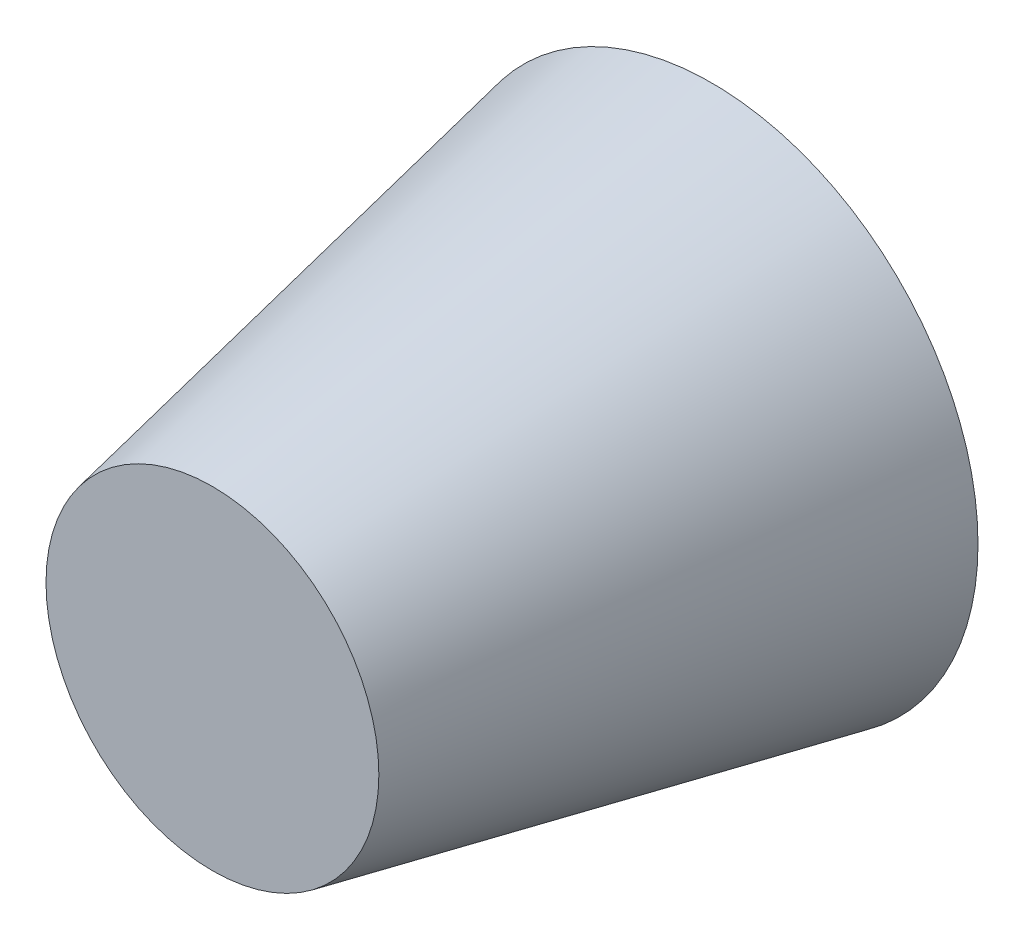
from build123d import *

# Parameters (mm, degrees)
SKETCH_7_R          = 2.9
CUT_EXTRUDE_1_DEPTH = 6


# Read off the part's stored shape, not the designer's step: 边界1
with BuildPart() as part:
    # 边界1 outline → 边界1 (revolve)
    with BuildSketch(Plane.XZ):
        Polygon((8, 0), (5, 15), (0, 15), (0, 0), align=None)
    revolve(axis=Axis((0, 0, 0), (0, 0, 1)))

    # 草图7 → 切除-拉伸1 (cut)
    with BuildSketch(Plane(origin=(0, 0, 0), x_dir=(-1, 0, 0), z_dir=(0, 0, -1))):
        Circle(SKETCH_7_R)
    extrude(amount=-CUT_EXTRUDE_1_DEPTH, mode=Mode.SUBTRACT)


solid = part.part
